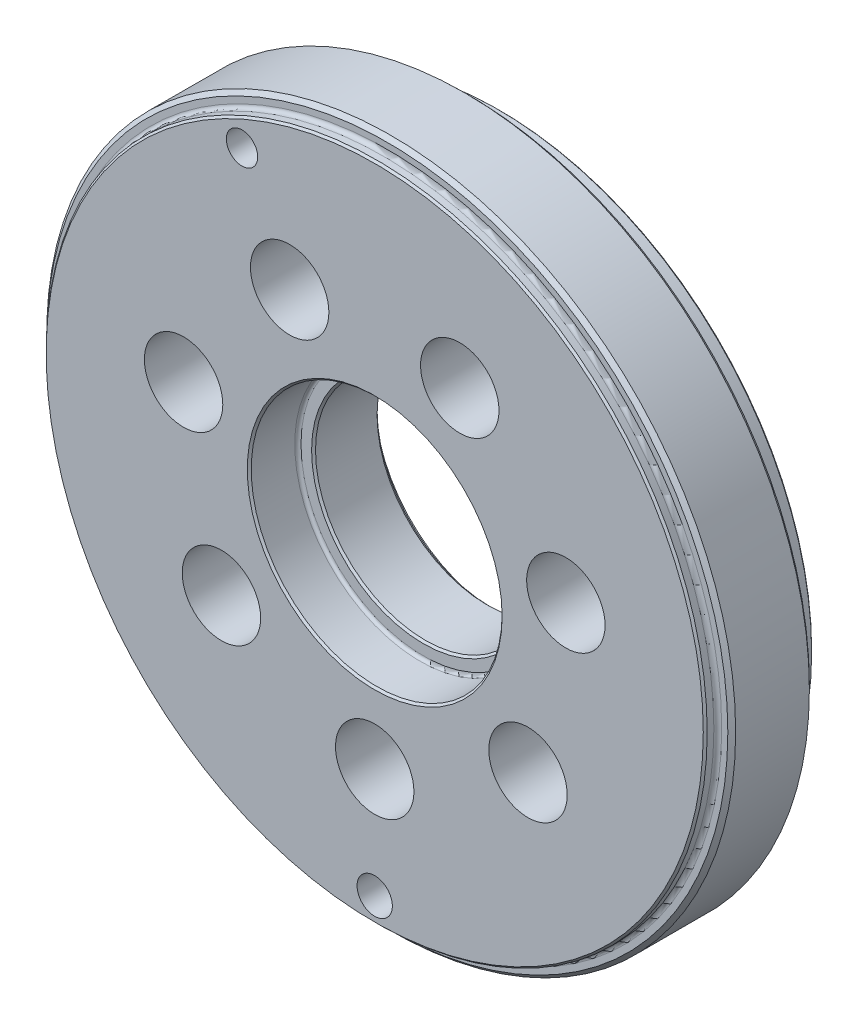
from build123d import *

# Parameters (mm, degrees)
SKETCH1_R                      = 43.93
SKETCH1_R_2                    = 14
EXTRUDE1_DEPTH                 = 16
EXTRUDE7_DEPTH                 = 2
CUT_EXTRUDE5_DEPTH             = 0.6
CIRPATTERN3_COUNT              = 7
EXTRUDE8_REACH                 = 65.684
SKETCH10_R                     = 5
CIRPATTERN2_COUNT              = 7
F_4_0_4_DIAMETER_HOLE1_D       = 4
F_4_0_4_DIAMETER_HOLE1_DEPTH   = 6
F_4_0_4_DIAMETER_HOLE1_TIP     = 1.201721238
F_4_5_4_5_DIAMETER_HOLE2_D     = 4.5
F_4_5_4_5_DIAMETER_HOLE2_DEPTH = 13.5
F_4_5_4_5_DIAMETER_HOLE2_TIP   = 1.351936393
CHAMFER1_SIZE                  = 0.5


with BuildPart() as part:
    # Sketch1 → Extrude1 (new body)
    with BuildSketch(Plane.XY):
        Circle(SKETCH1_R)
        Circle(SKETCH1_R_2, mode=Mode.SUBTRACT)
    extrude(amount=-EXTRUDE1_DEPTH)

    # Sketch13 → Cut-Revolve1 (revolve, cut)
    with BuildSketch(Plane(origin=(0, 0, 0), x_dir=(0, 0, -1), z_dir=(1, 0, 0))):
        with BuildLine():
            Line((5.8, 16), (0.25, 16))
            Line((0.25, 16), (0, 16.25))
            Line((0, 16.25), (0, 41.9))
            Line((0, 41.9), (0.25, 42.15))
            Line((0.25, 42.15), (1.1, 42.15))
            ThreePointArc((1.1, 42.15), (1.453553391, 42.296446609), (1.6, 42.65))
            Line((1.6, 42.65), (1.6, 50.047434563))
            Line((1.6, 50.047434563), (-4.843089059, 50.047434563))
            Line((-4.843089059, 50.047434563), (-4.843089059, 0))
            Line((-4.843089059, 0), (0, 0))
            Line((0, 0), (19.04869502, 0))
            Line((19.04869502, 0), (19.04869502, 50.047434563))
            Line((19.04869502, 50.047434563), (12, 50.047434563))
            Line((12, 50.047434563), (12, 40.37))
            ThreePointArc((12, 40.37), (12.117157288, 40.087157288), (12.4, 39.97))
            Line((12.4, 39.97), (15.75, 39.97))
            Line((15.75, 39.97), (16, 39.72))
            Line((16, 39.72), (16, 16))
            Line((16, 16), (15.2, 16))
            ThreePointArc((15.2, 16), (14.917157288, 15.882842712), (14.8, 15.6))
            Line((14.8, 15.6), (14.8, 14.5))
            Line((14.8, 14.5), (14.3, 14))
            Line((14.3, 14), (6.45, 14))
            Line((6.45, 14), (6.2, 14.25))
            Line((6.2, 14.25), (6.2, 15.6))
            ThreePointArc((6.2, 15.6), (6.082842712, 15.882842712), (5.8, 16))
        make_face()
    revolve(axis=Axis((0, 0, 0), (0, 0, -1)), mode=Mode.SUBTRACT)

    # Sketch9 → Extrude7 (cut)
    with BuildSketch(Plane(origin=(0, 0, -16), x_dir=(-1, 0, 0), z_dir=(0, 0, -1))):
        with BuildLine():
            Line((-3, -23), (-3, -27))
            ThreePointArc((-3, -27), (0, -30), (3, -27))
            Line((3, -27), (3, -23))
            ThreePointArc((3, -23), (0, -20), (-3, -23))
        make_face()
    extrude7 = extrude(amount=-EXTRUDE7_DEPTH, mode=Mode.SUBTRACT)

    # Sketch18 → Cut-Extrude5 (cut)
    with BuildSketch(Plane(origin=(0, 0, -16), x_dir=(-1, 0, 0), z_dir=(0, 0, -1))):
        with BuildLine():
            Line((12.682232603, -19.420632744), (14.41776756, -23.024508216))
            ThreePointArc((14.41776756, -23.024508216), (13.016512174, -27.029066037), (9.011954352, -25.627810651))
            Line((9.011954352, -25.627810651), (7.276419396, -22.023935179))
            ThreePointArc((7.276419396, -22.023935179), (8.677674782, -18.019377358), (12.682232603, -19.420632744))
        make_face()
    cut_extrude5 = extrude(amount=-CUT_EXTRUDE5_DEPTH, mode=Mode.SUBTRACT)

    # CirPattern3: Cut-Extrude5 ×7 about axis
    cirpattern3_axis = Axis((0, 0, -16), (0, 0, 1))
    for i in range(1, CIRPATTERN3_COUNT):
        add(cut_extrude5.rotate(cirpattern3_axis, i * 360 / CIRPATTERN3_COUNT), mode=Mode.SUBTRACT)

    # Sketch10 → Extrude8 (cut, up to next)
    with BuildSketch(Plane(origin=(0, 0, -14), x_dir=(-1, 0, 0), z_dir=(0, 0, -1)), mode=Mode.PRIVATE) as extrude8_sk1:
        with Locations((0, -25)):
            Circle(SKETCH10_R)
    extrude8_tool1 = extrude(extrude8_sk1.sketch, amount=-EXTRUDE8_REACH, mode=Mode.PRIVATE) & part.part
    extrude8 = extrude8_tool1.solids().sort_by_distance((0, -25, -14))[0]
    add(extrude8, mode=Mode.SUBTRACT)

    # CirPattern2: Extrude7, Extrude8 ×7 about axis
    cirpattern2_axis = Axis((0, 0, -16), (0, 0, 1))
    add([extrude7.rotate(cirpattern2_axis, i * 360 / CIRPATTERN2_COUNT) for i in range(1, CIRPATTERN2_COUNT)], mode=Mode.SUBTRACT)
    add([extrude8.rotate(cirpattern2_axis, i * 360 / CIRPATTERN2_COUNT) for i in range(1, CIRPATTERN2_COUNT)], mode=Mode.SUBTRACT)

    # Ø4.0 (4) Diameter Hole1
    with Locations(Plane.XY):
        with Locations((-16.921465826, 35.137785848)):
            Hole(F_4_0_4_DIAMETER_HOLE1_D / 2, depth=F_4_0_4_DIAMETER_HOLE1_DEPTH)
            with Locations((0, 0, -(F_4_0_4_DIAMETER_HOLE1_DEPTH + F_4_0_4_DIAMETER_HOLE1_TIP / 2))):  # 118° drill point
                Cone(0, F_4_0_4_DIAMETER_HOLE1_D / 2, F_4_0_4_DIAMETER_HOLE1_TIP, mode=Mode.SUBTRACT)

    # Ø4.5 (4.5) Diameter Hole2
    with Locations(Plane.XY):
        with Locations((0, -39)):
            Hole(F_4_5_4_5_DIAMETER_HOLE2_D / 2, depth=F_4_5_4_5_DIAMETER_HOLE2_DEPTH)
            with Locations((0, 0, -(F_4_5_4_5_DIAMETER_HOLE2_DEPTH + F_4_5_4_5_DIAMETER_HOLE2_TIP / 2))):  # 118° drill point
                Cone(0, F_4_5_4_5_DIAMETER_HOLE2_D / 2, F_4_5_4_5_DIAMETER_HOLE2_TIP, mode=Mode.SUBTRACT)

    # Chamfer1
    chamfer1_edges = [part.edges().sort_by_distance(p)[0] for p in [
        (-43.93, 0, -1.6),
        (-43.93, 0, -12),
    ]]
    chamfer(chamfer1_edges, length=CHAMFER1_SIZE)


solid = part.part
